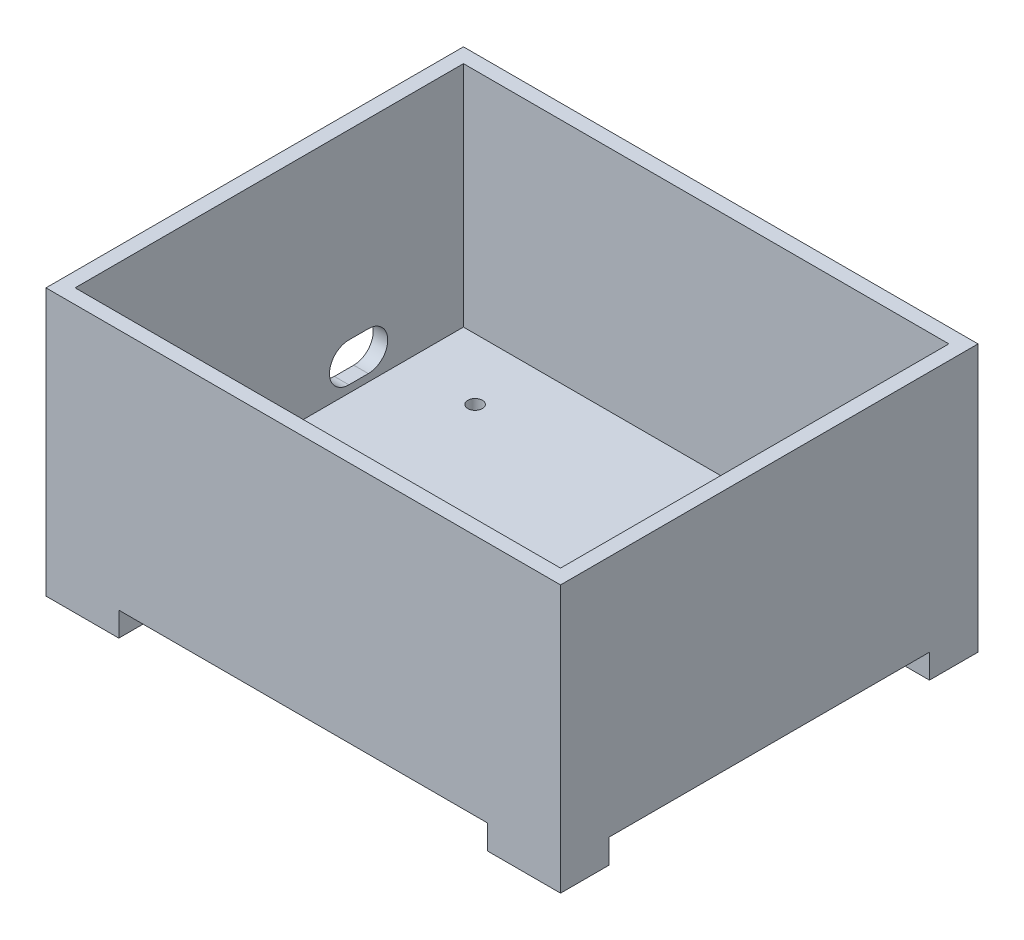
from build123d import *

# Parameters (mm, degrees)
SCHIZZO1_W                   = 100
SCHIZZO1_H                   = 80
SCHIZZO1_R                   = 1.5
ESTRUSIONE_ESTRUSIONE1_DEPTH = 3
SCHIZZO2_W                   = 100
SCHIZZO2_H                   = 50
ESTRUSIONE_ESTRUSIONE2_DEPTH = 3
SCHIZZO3_W                   = 86
SCHIZZO3_H                   = 50
ESTRUSIONE_ESTRUSIONE3_DEPTH = 3
TAGLIO_ESTRUSIONE1_DEPTH     = 10
SCHIZZO6_W                   = 15
SCHIZZO6_H                   = 10
ESTRUSIONE_ESTRUSIONE4_DEPTH = 5


with BuildPart() as part:
    # Schizzo1 → Estrusione-Estrusione1 (new body)
    with BuildSketch(Plane(origin=(0, 0, 0), x_dir=(1, 0, 0), z_dir=(0, 1, 0))):
        with Locations((50, 40)):
            Rectangle(SCHIZZO1_W, SCHIZZO1_H)
        with Locations((15, 67.4)):
            Circle(SCHIZZO1_R, mode=Mode.SUBTRACT)
        with Locations((15, 12.6)):
            Circle(SCHIZZO1_R, mode=Mode.SUBTRACT)
        with Locations((76.978953205, 59.25)):
            Circle(SCHIZZO1_R, mode=Mode.SUBTRACT)
        with Locations((76.978953205, 20.75)):
            Circle(SCHIZZO1_R, mode=Mode.SUBTRACT)
    extrude(amount=ESTRUSIONE_ESTRUSIONE1_DEPTH)

    # Schizzo2 → Estrusione-Estrusione2 (add)
    with BuildSketch(Plane.XY):
        with Locations((50, 25)):
            Rectangle(SCHIZZO2_W, SCHIZZO2_H)
    estrusione_estrusione2 = extrude(amount=ESTRUSIONE_ESTRUSIONE2_DEPTH)

    # Specchia1: Estrusione-Estrusione2 across plane
    add(estrusione_estrusione2.mirror(Plane.XY.offset(-40)))

    # Schizzo3 → Estrusione-Estrusione3 (add)
    with BuildSketch(Plane.ZY):
        with Locations((-40, 25)):
            Rectangle(SCHIZZO3_W, SCHIZZO3_H)
    estrusione_estrusione3 = extrude(amount=ESTRUSIONE_ESTRUSIONE3_DEPTH)

    # Specchia2: Estrusione-Estrusione3 across plane
    add(estrusione_estrusione3.mirror(Plane(origin=(50, 0, 0), x_dir=(0, 0, 1), z_dir=(1, 0, 0))))

    # Schizzo4 → Taglio-Estrusione1 (cut)
    with BuildSketch(Plane.ZY.offset(3)):
        with BuildLine():
            Line((-60.4, 12.5), (-56.4, 12.5))
            ThreePointArc((-56.4, 12.5), (-52.4, 8.5), (-56.4, 4.5))
            Line((-56.4, 4.5), (-60.4, 4.5))
            ThreePointArc((-60.4, 4.5), (-64.4, 8.5), (-60.4, 12.5))
        make_face()
    extrude(amount=-TAGLIO_ESTRUSIONE1_DEPTH, mode=Mode.SUBTRACT)

    # Schizzo6 → Estrusione-Estrusione4 (add)
    with BuildSketch(Plane.XZ):
        with Locations((95.5, -2)):
            Rectangle(SCHIZZO6_W, SCHIZZO6_H)
        with Locations((4.5, -2)):
            Rectangle(SCHIZZO6_W, SCHIZZO6_H)
        with Locations((95.5, -78)):
            Rectangle(SCHIZZO6_W, SCHIZZO6_H)
        with Locations((4.5, -78)):
            Rectangle(SCHIZZO6_W, SCHIZZO6_H)
    extrude(amount=ESTRUSIONE_ESTRUSIONE4_DEPTH)


solid = part.part
